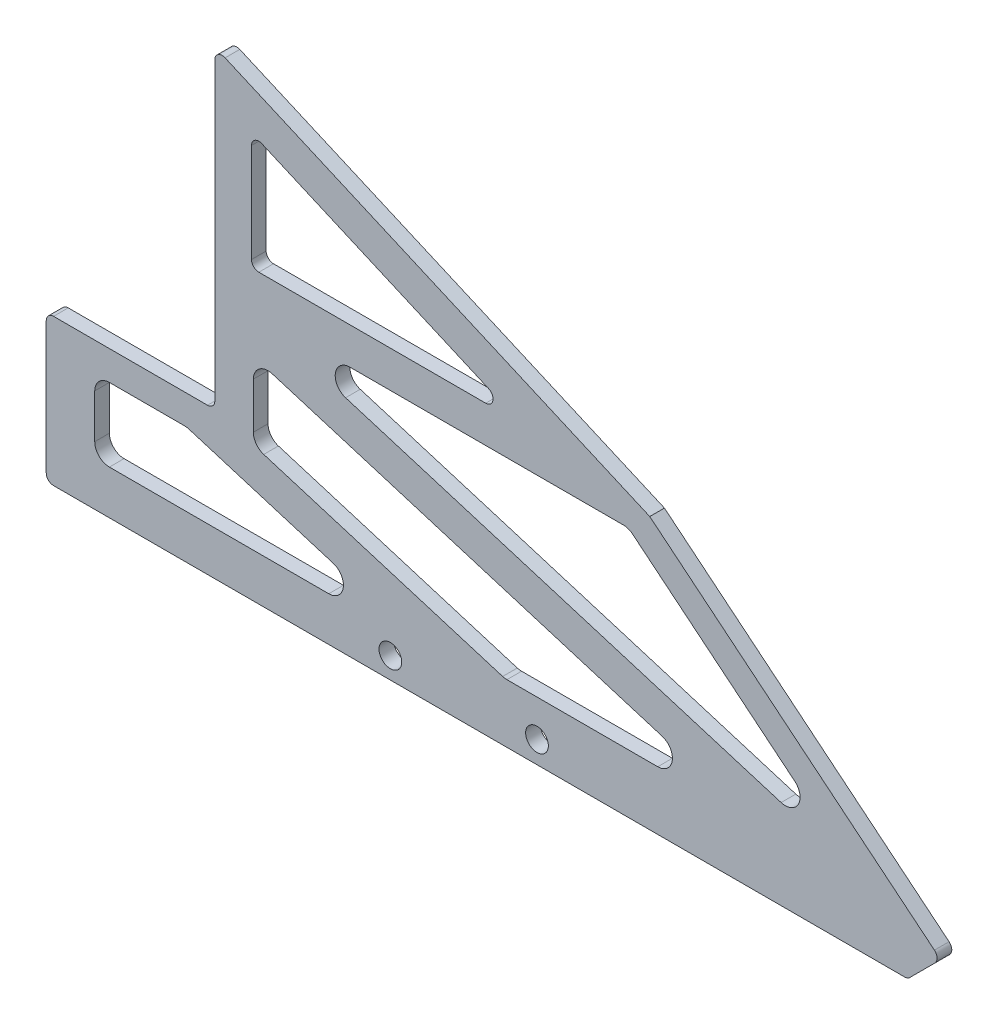
from build123d import *

# Parameters (mm, degrees)
BOSS_EXTRUDE1_DEPTH     = 2
CUT_EXTRUDE1_DEPTH      = 194.041099928
CUT_EXTRUDE1_DEPTH_BACK = 194.041099928
SKETCH3_R               = 1.55
CUT_EXTRUDE2_DEPTH      = 166.312637063
CHAMFER1_SIZE           = 10
CHAMFER1_SIZE2          = 7.10587207
SKETCH4_W               = 23
SKETCH4_H               = 20
BOSS_EXTRUDE2_DEPTH     = 2
CUT_EXTRUDE3_DEPTH      = 10
FILLET1_R               = 1
FILLET2_R               = 2


with BuildPart() as part:
    # Sketch1 → Boss-Extrude1 (new body)
    with BuildSketch(Plane.XY):
        Polygon((0.281061297, 65), (0.281061297, 127.843273187), (144.626981447, 65), align=None)
    extrude(amount=BOSS_EXTRUDE1_DEPTH)

    # Sketch2 → Cut-Extrude1 (cut, two sides: drawn at the far end of the back side and taken through both)
    with BuildSketch(Plane(origin=(0, 0, 0), x_dir=(-1, 0, 0), z_dir=(0, 0, -1)).offset(-CUT_EXTRUDE1_DEPTH_BACK)):
        Polygon((-59.60753821, 102.014555673), (-104.787239078, 65), (-144.626981447, 65), align=None)
    extrude(amount=CUT_EXTRUDE1_DEPTH + CUT_EXTRUDE1_DEPTH_BACK, mode=Mode.SUBTRACT)

    # Sketch3 → Cut-Extrude2 (cut, through all)
    with BuildSketch(Plane.XY.offset(2)):
        with Locations((24.221384752, 67.893564036)):
            Circle(SKETCH3_R)
        with Locations((44.221384752, 68)):
            Circle(SKETCH3_R)
    extrude(amount=-CUT_EXTRUDE2_DEPTH, mode=Mode.SUBTRACT)

    # Chamfer1
    chamfer1_edges = [part.edges().sort_by_distance(p)[0] for p in [
        (104.787239078, 65, 1),
    ]]
    chamfer1_side = [part.faces().sort_by_distance(p)[0] for p in [
        (52.534150187, 65, 1),
    ]]
    chamfer(chamfer1_edges, length=CHAMFER1_SIZE, length2=CHAMFER1_SIZE2, reference=chamfer1_side[0])

    # Sketch4 → Boss-Extrude2 (add)
    with BuildSketch(Plane(origin=(0, 0, 0), x_dir=(-1, 0, 0), z_dir=(0, 0, -1))):
        with Locations((11.218938703, 75)):
            Rectangle(SKETCH4_W, SKETCH4_H)
    extrude(amount=-BOSS_EXTRUDE2_DEPTH)

    # Sketch5 → Cut-Extrude3 (cut)
    with BuildSketch(Plane.XY.offset(2)):
        Polygon((5.281061297, 120.213134872), (42.031768338, 104.213134872), (5.281061297, 104.213134872), align=None)
        Polygon((5.281061297, 99.213134872), (56.715232925, 99.213134872), (87.201486277, 74.236539183), align=None)
        Polygon((5.533576354, 93.908916748), (74.112471858, 73), (39.823024106, 73), (5.533576354, 83.454458374), align=None)
        Polygon((-16.104128456, 81), (-3.560800085, 81), (29.238075309, 71), (-16.104128456, 71), align=None)
    extrude(amount=-CUT_EXTRUDE3_DEPTH, mode=Mode.SUBTRACT)

    # Fillet1
    fillet1_edges = [part.edges().sort_by_distance(p)[0] for p in [
        (42.031768338, 104.213134872, 1),
        (5.281061297, 120.213134872, 1),
        (5.281061297, 104.213134872, 1),
        (0.281061297, 127.843273187, 1),
        (94.787239078, 65, 1),
        (99.29054104, 69.503301962, 1),
        (-22.718938703, 65, 1),
        (-22.718938703, 85, 1),
        (0.281061297, 85, 1),
    ]]
    fillet(fillet1_edges, radius=FILLET1_R)

    # Fillet2
    fillet2_edges = [part.edges().sort_by_distance(p)[0] for p in [
        (-3.560800085, 81, 1),
        (-16.104128456, 81, 1),
        (-16.104128456, 71, 1),
        (29.238075309, 71, 1),
        (39.823024106, 73, 1),
        (5.533576354, 83.454458374, 1),
        (5.533576354, 93.908916748, 1),
        (74.112471858, 73, 1),
        (87.201486277, 74.236539183, 1),
        (56.715232925, 99.213134872, 1),
        (5.281061297, 99.213134872, 1),
    ]]
    fillet(fillet2_edges, radius=FILLET2_R)


solid = part.part
